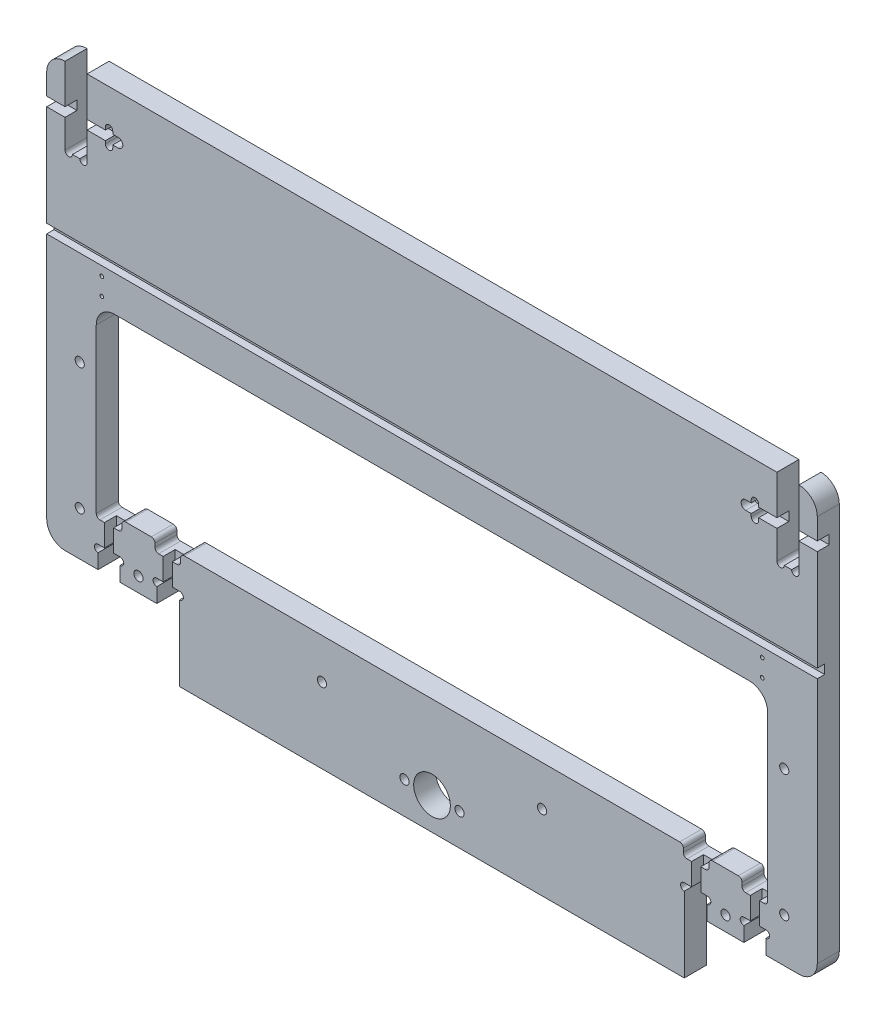
from build123d import *

# Parameters (mm, degrees)
SKETCH1_W                = 275
SKETCH1_H                = 33
BOSS_EXTRUDE1_DEPTH      = 12
CUT_EXTRUDE1_REACH       = 141.005
SKETCH2_R                = 10
SKETCH2_R_2              = 2.5
SKETCH3_W                = 366
SKETCH3_H                = 95
BOSS_EXTRUDE2_DEPTH      = 12
CUT_EXTRUDE3_REACH       = 326.808
SKETCH5_W                = 14
SKETCH5_H                = 6
FILLET1_R                = 2
FILLET1_OF_MIRROR2_R     = 2
CUT_EXTRUDE6_REACH       = 326.808
SKETCH8_W                = 12
SKETCH8_H                = 42
F_5_0_5_DIAMETER_HOLE2_D = 5
CUT_EXTRUDE9_DEPTH       = 8
CUT_EXTRUDE10_DEPTH      = 6.5
F_5_0_5_DIAMETER_HOLE1_D = 5
F_2_0_2_DIAMETER_HOLE1_D = 2
SKETCH21_W               = 446.80085783
SKETCH21_H               = 5
CUT_EXTRUDE7_DEPTH       = 4
FILLET2_R                = 10
SKETCH25_W               = 5
SKETCH25_H               = 24
CUT_EXTRUDE11_DEPTH      = 6.5
CUT_EXTRUDE12_REACH      = 326.808
CUT_EXTRUDE13_REACH      = 326.808
SKETCH27_R               = 2


with BuildPart() as part:
    # Sketch1 → Boss-Extrude1 (new body)
    with BuildSketch(Plane.XY):
        Rectangle(SKETCH1_W, SKETCH1_H)
    extrude(amount=BOSS_EXTRUDE1_DEPTH)

    # Sketch2 → Cut-Extrude1 (cut, up to next)
    with BuildSketch(Plane.XY.offset(12), mode=Mode.PRIVATE) as cut_extrude1_sk1:
        with Locations((0, 1)):
            Circle(SKETCH2_R)
    cut_extrude1_tool1 = extrude(cut_extrude1_sk1.sketch, amount=-CUT_EXTRUDE1_REACH, mode=Mode.PRIVATE) & part.part
    # Sketch2 → Cut-Extrude1 (cut, up to next)
    with BuildSketch(Plane.XY.offset(12), mode=Mode.PRIVATE) as cut_extrude1_sk2:
        with Locations((-15, 1)):
            Circle(SKETCH2_R_2)
    cut_extrude1_tool2 = extrude(cut_extrude1_sk2.sketch, amount=-CUT_EXTRUDE1_REACH, mode=Mode.PRIVATE) & part.part
    # Sketch2 → Cut-Extrude1 (cut, up to next)
    with BuildSketch(Plane.XY.offset(12), mode=Mode.PRIVATE) as cut_extrude1_sk3:
        with Locations((15, 1)):
            Circle(SKETCH2_R_2)
    cut_extrude1_tool3 = extrude(cut_extrude1_sk3.sketch, amount=-CUT_EXTRUDE1_REACH, mode=Mode.PRIVATE) & part.part
    add(cut_extrude1_tool1.solids().sort_by_distance((0, 1, 12))[0], mode=Mode.SUBTRACT)
    add(cut_extrude1_tool2.solids().sort_by_distance((-15, 1, 12))[0], mode=Mode.SUBTRACT)
    add(cut_extrude1_tool3.solids().sort_by_distance((15, 1, 12))[0], mode=Mode.SUBTRACT)

    # Sketch3 → Boss-Extrude2 (add)
    with BuildSketch(Plane.XY.offset(12)):
        Polygon((-210, 16.5), (210, 16.5), (210, 46.5), (210, 247.5), (-210, 247.5), (-210, 46.5), align=None)
        with Locations((0, 94)):
            Rectangle(SKETCH3_W, SKETCH3_H, mode=Mode.SUBTRACT)
    extrude(amount=-BOSS_EXTRUDE2_DEPTH)

    # Sketch5 → Cut-Extrude3 (cut, up to next)
    with BuildSketch(Plane.XY.offset(12), mode=Mode.PRIVATE) as cut_extrude3_sk1:
        with Locations((-176, 43.5)):
            Rectangle(SKETCH5_W, SKETCH5_H)
    cut_extrude3_tool1 = extrude(cut_extrude3_sk1.sketch, amount=-CUT_EXTRUDE3_REACH, mode=Mode.PRIVATE) & part.part
    # Sketch5 → Cut-Extrude3 (cut, up to next)
    with BuildSketch(Plane.XY.offset(12), mode=Mode.PRIVATE) as cut_extrude3_sk2:
        with Locations((-144, 43.5)):
            Rectangle(SKETCH5_W, SKETCH5_H)
    cut_extrude3_tool2 = extrude(cut_extrude3_sk2.sketch, amount=-CUT_EXTRUDE3_REACH, mode=Mode.PRIVATE) & part.part
    cut_extrude3_1 = cut_extrude3_tool1.solids().sort_by_distance((-176, 43.5, 12))[0]
    add(cut_extrude3_1, mode=Mode.SUBTRACT)
    cut_extrude3_2 = cut_extrude3_tool2.solids().sort_by_distance((-144, 43.5, 12))[0]
    add(cut_extrude3_2, mode=Mode.SUBTRACT)
    cut_extrude3 = cut_extrude3_1 + cut_extrude3_2  # Cut-Extrude3 as one shape, for the pattern or mirror that repeats it

    # Fillet1
    fillet1_edges = [part.edges().sort_by_distance(p)[0] for p in [
        (-169, 46.5, 6),
        (-169, 40.5, 6),
        (-183, 40.5, 6),
        (-151, 46.5, 6),
        (-137, 46.5, 6),
        (-137, 40.5, 6),
        (-151, 40.5, 6),
    ]]
    fillet(fillet1_edges, radius=FILLET1_R)

    # Mirror2: Cut-Extrude3 across plane
    add(cut_extrude3.mirror(Plane(origin=(0, 0, 0), x_dir=(0, 0, 1), z_dir=(1, 0, 0))), mode=Mode.SUBTRACT)

    # Fillet1 of Mirror2
    fillet1_of_mirror2_edges = [part.edges().sort_by_distance(p)[0] for p in [
        (169, 46.5, 6),
        (169, 40.5, 6),
        (183, 40.5, 6),
        (151, 46.5, 6),
        (137, 46.5, 6),
        (137, 40.5, 6),
        (151, 40.5, 6),
    ]]
    fillet(fillet1_of_mirror2_edges, radius=FILLET1_OF_MIRROR2_R)

    # Sketch8 → Cut-Extrude6 (cut, up to next)
    with BuildSketch(Plane.XY.offset(12), mode=Mode.PRIVATE) as cut_extrude6_sk1:
        with Locations((-194, 226.5)):
            Rectangle(SKETCH8_W, SKETCH8_H)
    cut_extrude6_tool1 = extrude(cut_extrude6_sk1.sketch, amount=-CUT_EXTRUDE6_REACH, mode=Mode.PRIVATE) & part.part
    # Sketch8 → Cut-Extrude6 (cut, up to next)
    with BuildSketch(Plane.XY.offset(12), mode=Mode.PRIVATE) as cut_extrude6_sk2:
        with Locations((194, 226.5)):
            Rectangle(SKETCH8_W, SKETCH8_H)
    cut_extrude6_tool2 = extrude(cut_extrude6_sk2.sketch, amount=-CUT_EXTRUDE6_REACH, mode=Mode.PRIVATE) & part.part
    add(cut_extrude6_tool1.solids().sort_by_distance((-194, 226.5, 12))[0], mode=Mode.SUBTRACT)
    add(cut_extrude6_tool2.solids().sort_by_distance((194, 226.5, 12))[0], mode=Mode.SUBTRACT)

    # Ø5.0 (5) Diameter Hole2 (through all)
    with Locations(Plane(origin=(0, 0, 0), x_dir=(-1, 0, 0), z_dir=(0, 0, -1))):
        with Locations((192, 109.5), (192, 40.5)):
            f_5_0_5_diameter_hole2 = Hole(F_5_0_5_DIAMETER_HOLE2_D / 2)

    # Mirror3: Ø5.0 (5) Diameter Hole2 across plane
    add(f_5_0_5_diameter_hole2.mirror(Plane(origin=(0, 0, 0), x_dir=(0, 0, 1), z_dir=(1, 0, 0))), mode=Mode.SUBTRACT)

    # Sketch23 → Cut-Extrude9 (cut)
    with BuildSketch(Plane.XY.offset(12)):
        with BuildLine():
            Line((-178, 219.5), (-178, 227.5))
            ThreePointArc((-178, 227.5), (-176, 229.5), (-174, 227.5))
            Line((-174, 227.5), (-174, 219.5))
            ThreePointArc((-174, 219.5), (-176, 217.5), (-178, 219.5))
        make_face()
    cut_extrude9 = extrude(amount=-CUT_EXTRUDE9_DEPTH, mode=Mode.SUBTRACT)

    # Sketch24 → Cut-Extrude10 (cut)
    with BuildSketch(Plane.XY.offset(12)):
        with BuildLine():
            Line((-222.733424796, 226), (-171, 226))
            ThreePointArc((-171, 226), (-168.5, 223.5), (-171, 221))
            Line((-171, 221), (-222.733424796, 221))
            ThreePointArc((-222.733424796, 221), (-225.233424796, 223.5), (-222.733424796, 226))
        make_face()
    cut_extrude10 = extrude(amount=-CUT_EXTRUDE10_DEPTH, mode=Mode.SUBTRACT)

    # Ø5.0 (5) Diameter Hole1 (through all)
    with Locations(Plane(origin=(0, 0, 0), x_dir=(-1, 0, 0), z_dir=(0, 0, -1))):
        with Locations((-60, 24.5), (60, 24.5), (160, 24.5), (-160, 24.5)):
            Hole(F_5_0_5_DIAMETER_HOLE1_D / 2)

    # Ø2.0 (2) Diameter Hole1 (through all)
    with Locations(Plane.XY.offset(12)):
        with Locations((-180, 156), (-180, 146.5)):
            f_2_0_2_diameter_hole1 = Hole(F_2_0_2_DIAMETER_HOLE1_D / 2)

    # Mirror4: Cut-Extrude9, Cut-Extrude10, Ø2.0 (2) Diameter Hole1 across plane
    add(cut_extrude9.mirror(Plane(origin=(0, 0, 0), x_dir=(0, 0, 1), z_dir=(1, 0, 0))), mode=Mode.SUBTRACT)
    add(cut_extrude10.mirror(Plane(origin=(0, 0, 0), x_dir=(0, 0, 1), z_dir=(1, 0, 0))), mode=Mode.SUBTRACT)
    add(f_2_0_2_diameter_hole1.mirror(Plane(origin=(0, 0, 0), x_dir=(0, 0, 1), z_dir=(1, 0, 0))), mode=Mode.SUBTRACT)

    # Sketch21 → Cut-Extrude7 (cut)
    with BuildSketch(Plane.XY.offset(12)):
        with Locations((9.659590627, 163.5)):
            Rectangle(SKETCH21_W, SKETCH21_H)
    extrude(amount=-CUT_EXTRUDE7_DEPTH, mode=Mode.SUBTRACT)

    # Fillet2
    fillet2_edges = [part.edges().sort_by_distance(p)[0] for p in [
        (210, 247.5, 6),
        (210, 16.5, 6),
        (-210, 16.5, 6),
        (-210, 247.5, 6),
        (183, 141.5, 6),
        (-183, 141.5, 6),
    ]]
    fillet(fillet2_edges, radius=FILLET2_R - 0.0001)  # a hair under: the kernel refuses the full size

    # Sketch25 → Cut-Extrude11 (cut)
    with BuildSketch(Plane.XY.offset(12)):
        with Locations((-176, 40.5)):
            Rectangle(SKETCH25_W, SKETCH25_H)
        with Locations((-144, 40.5)):
            Rectangle(SKETCH25_W, SKETCH25_H)
    cut_extrude11 = extrude(amount=-CUT_EXTRUDE11_DEPTH, mode=Mode.SUBTRACT)

    # Sketch26 → Cut-Extrude12 (cut, up to next)
    with BuildSketch(Plane.XY.offset(12), mode=Mode.PRIVATE) as cut_extrude12_sk1:
        with BuildLine():
            Line((-182, 16.5), (-170, 16.5))
            Line((-170, 16.5), (-170, 24.5))
            ThreePointArc((-170, 24.5), (-168, 26.5), (-170, 28.5))
            Line((-170, 28.5), (-182, 28.5))
            ThreePointArc((-182, 28.5), (-184, 26.5), (-182, 24.5))
            Line((-182, 24.5), (-182, 16.5))
        make_face()
    cut_extrude12_tool1 = extrude(cut_extrude12_sk1.sketch, amount=-CUT_EXTRUDE12_REACH, mode=Mode.PRIVATE) & part.part
    # Sketch26 → Cut-Extrude12 (cut, up to next)
    with BuildSketch(Plane.XY.offset(12), mode=Mode.PRIVATE) as cut_extrude12_sk2:
        with BuildLine():
            Line((-150, 16.5), (-137.5, 16.5))
            Line((-137.5, 16.5), (-137.5, 24.5))
            ThreePointArc((-137.5, 24.5), (-135.5, 26.5), (-137.5, 28.5))
            Line((-137.5, 28.5), (-150, 28.5))
            ThreePointArc((-150, 28.5), (-152, 26.5), (-150, 24.5))
            Line((-150, 24.5), (-150, 16.5))
        make_face()
    cut_extrude12_tool2 = extrude(cut_extrude12_sk2.sketch, amount=-CUT_EXTRUDE12_REACH, mode=Mode.PRIVATE) & part.part
    cut_extrude12_1 = cut_extrude12_tool1.solids().sort_by_distance((-176, 22.821049, 12))[0]
    add(cut_extrude12_1, mode=Mode.SUBTRACT)
    cut_extrude12_2 = cut_extrude12_tool2.solids().sort_by_distance((-143.75, 22.8092, 12))[0]
    add(cut_extrude12_2, mode=Mode.SUBTRACT)
    cut_extrude12 = cut_extrude12_1 + cut_extrude12_2  # Cut-Extrude12 as one shape, for the pattern or mirror that repeats it

    # Mirror5: Cut-Extrude11, Cut-Extrude12 across plane
    add(cut_extrude11.mirror(Plane(origin=(0, 0, 0), x_dir=(0, 0, 1), z_dir=(1, 0, 0))), mode=Mode.SUBTRACT)
    add(cut_extrude12.mirror(Plane(origin=(0, 0, 0), x_dir=(0, 0, 1), z_dir=(1, 0, 0))), mode=Mode.SUBTRACT)

    # Sketch27 → Cut-Extrude13 (cut, up to next)
    with BuildSketch(Plane.XY.offset(12), mode=Mode.PRIVATE) as cut_extrude13_sk1:
        with Locations((-198, 205.5)):
            Circle(SKETCH27_R)
    cut_extrude13_tool1 = extrude(cut_extrude13_sk1.sketch, amount=-CUT_EXTRUDE13_REACH, mode=Mode.PRIVATE) & part.part
    # Sketch27 → Cut-Extrude13 (cut, up to next)
    with BuildSketch(Plane.XY.offset(12), mode=Mode.PRIVATE) as cut_extrude13_sk2:
        with Locations((-190, 205.5)):
            Circle(SKETCH27_R)
    cut_extrude13_tool2 = extrude(cut_extrude13_sk2.sketch, amount=-CUT_EXTRUDE13_REACH, mode=Mode.PRIVATE) & part.part
    # Sketch27 → Cut-Extrude13 (cut, up to next)
    with BuildSketch(Plane.XY.offset(12), mode=Mode.PRIVATE) as cut_extrude13_sk3:
        with Locations((190, 205.5)):
            Circle(SKETCH27_R)
    cut_extrude13_tool3 = extrude(cut_extrude13_sk3.sketch, amount=-CUT_EXTRUDE13_REACH, mode=Mode.PRIVATE) & part.part
    # Sketch27 → Cut-Extrude13 (cut, up to next)
    with BuildSketch(Plane.XY.offset(12), mode=Mode.PRIVATE) as cut_extrude13_sk4:
        with Locations((198, 205.5)):
            Circle(SKETCH27_R)
    cut_extrude13_tool4 = extrude(cut_extrude13_sk4.sketch, amount=-CUT_EXTRUDE13_REACH, mode=Mode.PRIVATE) & part.part
    add(cut_extrude13_tool1.solids().sort_by_distance((-198, 205.5, 12))[0], mode=Mode.SUBTRACT)
    add(cut_extrude13_tool2.solids().sort_by_distance((-190, 205.5, 12))[0], mode=Mode.SUBTRACT)
    add(cut_extrude13_tool3.solids().sort_by_distance((190, 205.5, 12))[0], mode=Mode.SUBTRACT)
    add(cut_extrude13_tool4.solids().sort_by_distance((198, 205.5, 12))[0], mode=Mode.SUBTRACT)


solid = part.part
